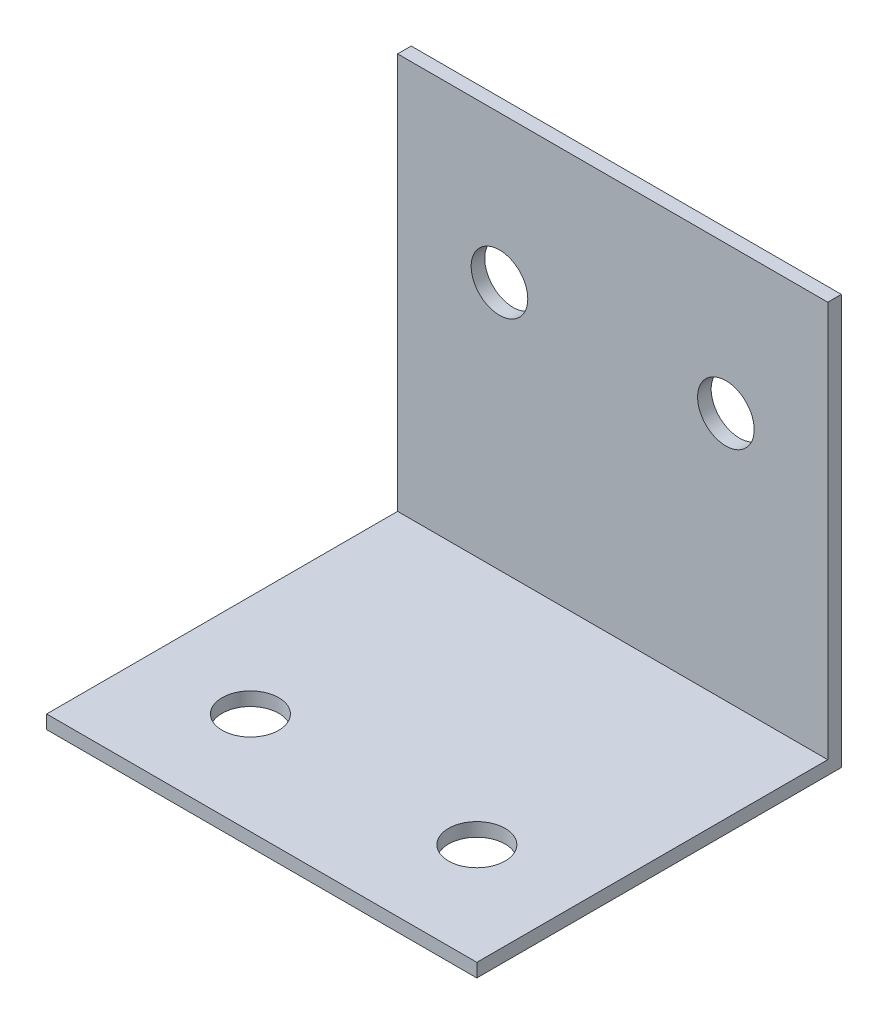
from build123d import *

# Parameters (mm, degrees)
SKETCH1_W           = 38
SKETCH1_H           = 32.2
SKETCH1_R           = 2.5
BOSS_EXTRUDE1_DEPTH = 1.2
SKETCH2_W           = 38
SKETCH2_H           = 1.2
BOSS_EXTRUDE2_DEPTH = 35
SKETCH3_R           = 2.5
CUT_EXTRUDE1_DEPTH  = 61.954409192


with BuildPart() as part:
    # Sketch1 → Boss-Extrude1 (new body)
    with BuildSketch(Plane(origin=(0, 0, 0), x_dir=(1, 0, 0), z_dir=(0, 1, 0))):
        with Locations((-19, -16.1)):
            Rectangle(SKETCH1_W, SKETCH1_H)
        with Locations((-29, -23.2)):
            Circle(SKETCH1_R, mode=Mode.SUBTRACT)
        with Locations((-9, -23.2)):
            Circle(SKETCH1_R, mode=Mode.SUBTRACT)
    extrude(amount=BOSS_EXTRUDE1_DEPTH)

    # Sketch2 → Boss-Extrude2 (add)
    with BuildSketch(Plane(origin=(0, 1.2, 0), x_dir=(1, 0, 0), z_dir=(0, 1, 0))):
        with Locations((-19, -0.6)):
            Rectangle(SKETCH2_W, SKETCH2_H)
    extrude(amount=BOSS_EXTRUDE2_DEPTH)

    # Sketch3 → Cut-Extrude1 (cut, through all)
    with BuildSketch(Plane.XY.offset(1.2)):
        with Locations((-29, 23.2)):
            Circle(SKETCH3_R)
        with Locations((-9, 23.2)):
            Circle(SKETCH3_R)
    extrude(amount=-CUT_EXTRUDE1_DEPTH, mode=Mode.SUBTRACT)


solid = part.part
